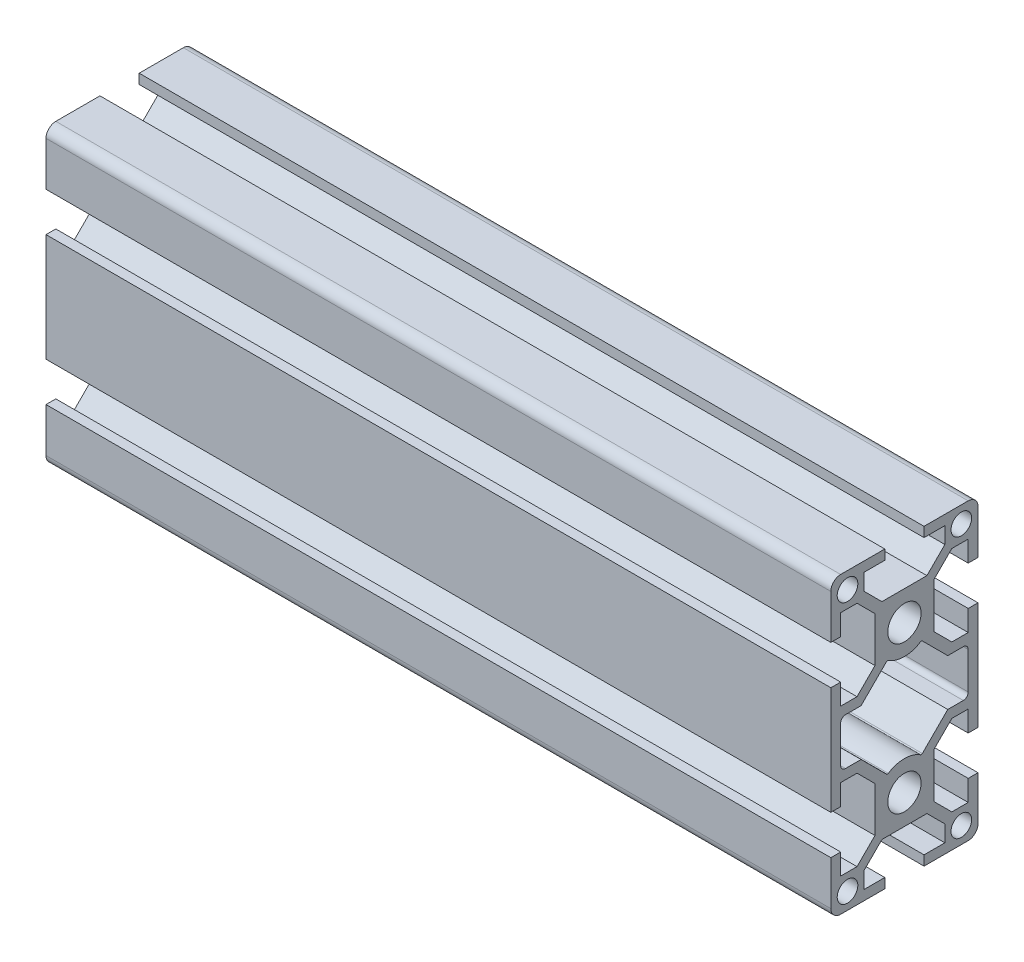
from build123d import *

# Parameters (mm, degrees)
SKETCH1_R           = 2.1
SKETCH1_R_2         = 3.4
BOSS_EXTRUDE1_DEPTH = 160


with BuildPart() as part:
    # Sketch1 → Boss-Extrude1 (new body)
    with BuildSketch(Plane(origin=(0, 0, 0), x_dir=(0, 0, -1), z_dir=(1, 0, 0))):
        with BuildLine():
            Line((-15, 28), (-15, 19))
            Line((-15, 19), (-13, 19))
            Line((-13, 19), (-13, 23.25))
            Line((-13, 23.25), (-9.664213562, 23.25))
            Line((-9.664213562, 23.25), (-6, 19.585786438))
            Line((-6, 19.585786438), (-6, 10.414213562))
            Line((-6, 10.414213562), (-9.664213562, 6.75))
            Line((-9.664213562, 6.75), (-13, 6.75))
            Line((-13, 6.75), (-13, 11))
            Line((-13, 11), (-15, 11))
            Line((-15, 11), (-15, -11))
            Line((-15, -11), (-13, -11))
            Line((-13, -11), (-13, -6.75))
            Line((-13, -6.75), (-9.664213562, -6.75))
            Line((-9.664213562, -6.75), (-6, -10.414213562))
            Line((-6, -10.414213562), (-6, -19.585786438))
            Line((-6, -19.585786438), (-9.664213562, -23.25))
            Line((-9.664213562, -23.25), (-13, -23.25))
            Line((-13, -23.25), (-13, -19))
            Line((-13, -19), (-15, -19))
            Line((-15, -19), (-15, -28))
            ThreePointArc((-15, -28), (-14.414213562, -29.414213562), (-13, -30))
            Line((-13, -30), (-4, -30))
            Line((-4, -30), (-4, -28))
            Line((-4, -28), (-8.25, -28))
            Line((-8.25, -28), (-8.25, -24.664213562))
            Line((-8.25, -24.664213562), (-4.585786438, -21))
            Line((-4.585786438, -21), (4.585786438, -21))
            Line((4.585786438, -21), (8.25, -24.664213562))
            Line((8.25, -24.664213562), (8.25, -28))
            Line((8.25, -28), (4, -28))
            Line((4, -28), (4, -30))
            Line((4, -30), (13, -30))
            ThreePointArc((13, -30), (14.414213562, -29.414213562), (15, -28))
            Line((15, -28), (15, -19))
            Line((15, -19), (13, -19))
            Line((13, -19), (13, -23.25))
            Line((13, -23.25), (9.664213562, -23.25))
            Line((9.664213562, -23.25), (6, -19.585786438))
            Line((6, -19.585786438), (6, -10.414213562))
            Line((6, -10.414213562), (9.664213562, -6.75))
            Line((9.664213562, -6.75), (13, -6.75))
            Line((13, -6.75), (13, -11))
            Line((13, -11), (15, -11))
            Line((15, -11), (15, 11))
            Line((15, 11), (13, 11))
            Line((13, 11), (13, 6.75))
            Line((13, 6.75), (9.664213562, 6.75))
            Line((9.664213562, 6.75), (6, 10.414213562))
            Line((6, 10.414213562), (6, 19.585786438))
            Line((6, 19.585786438), (9.664213562, 23.25))
            Line((9.664213562, 23.25), (13, 23.25))
            Line((13, 23.25), (13, 19))
            Line((13, 19), (15, 19))
            Line((15, 19), (15, 28))
            ThreePointArc((15, 28), (14.414213562, 29.414213562), (13, 30))
            Line((13, 30), (4, 30))
            Line((4, 30), (4, 28))
            Line((4, 28), (8.25, 28))
            Line((8.25, 28), (8.25, 24.664213562))
            Line((8.25, 24.664213562), (4.585786438, 21))
            Line((4.585786438, 21), (-4.585786438, 21))
            Line((-4.585786438, 21), (-8.25, 24.664213562))
            Line((-8.25, 24.664213562), (-8.25, 28))
            Line((-8.25, 28), (-4, 28))
            Line((-4, 28), (-4, 30))
            Line((-4, 30), (-13, 30))
            ThreePointArc((-13, 30), (-14.414213562, 29.414213562), (-15, 28))
        make_face()
        with Locations((-11.6, 26.625)):
            Circle(SKETCH1_R, mode=Mode.SUBTRACT)
        with Locations((0, 15)):
            Circle(SKETCH1_R_2, mode=Mode.SUBTRACT)
        with Locations((11.6, 26.625)):
            Circle(SKETCH1_R, mode=Mode.SUBTRACT)
        with Locations((0, -15)):
            Circle(SKETCH1_R_2, mode=Mode.SUBTRACT)
        with Locations((-11.6, -26.625)):
            Circle(SKETCH1_R, mode=Mode.SUBTRACT)
        with Locations((11.6, -26.625)):
            Circle(SKETCH1_R, mode=Mode.SUBTRACT)
        with BuildLine():
            Line((-8.835786438, 4.75), (-12, 4.75))
            ThreePointArc((-12, 4.75), (-12.707106781, 4.457106781), (-13, 3.75))
            Line((-13, 3.75), (-13, -3.75))
            ThreePointArc((-13, -3.75), (-12.707106781, -4.457106781), (-12, -4.75))
            Line((-12, -4.75), (-8.835786438, -4.75))
            Line((-8.835786438, -4.75), (-3.651792162, -9.933994275))
            ThreePointArc((-3.651792162, -9.933994275), (-3.470780401, -10.020243756), (-3.275866789, -9.973202134))
            ThreePointArc((-3.275866789, -9.973202134), (0, -9), (3.275866789, -9.973202134))
            ThreePointArc((3.275866789, -9.973202134), (3.470780401, -10.020243756), (3.651792162, -9.933994275))
            Line((3.651792162, -9.933994275), (8.835786438, -4.75))
            Line((8.835786438, -4.75), (12, -4.75))
            ThreePointArc((12, -4.75), (12.707106781, -4.457106781), (13, -3.75))
            Line((13, -3.75), (13, 3.75))
            ThreePointArc((13, 3.75), (12.707106781, 4.457106781), (12, 4.75))
            Line((12, 4.75), (8.835786438, 4.75))
            Line((8.835786438, 4.75), (3.651792162, 9.933994275))
            ThreePointArc((3.651792162, 9.933994275), (3.470780401, 10.020243756), (3.275866789, 9.973202134))
            ThreePointArc((3.275866789, 9.973202134), (0, 9), (-3.275866789, 9.973202134))
            ThreePointArc((-3.275866789, 9.973202134), (-3.470780401, 10.020243756), (-3.651792162, 9.933994275))
            Line((-3.651792162, 9.933994275), (-8.835786438, 4.75))
        make_face(mode=Mode.SUBTRACT)
    extrude(amount=BOSS_EXTRUDE1_DEPTH)


solid = part.part
